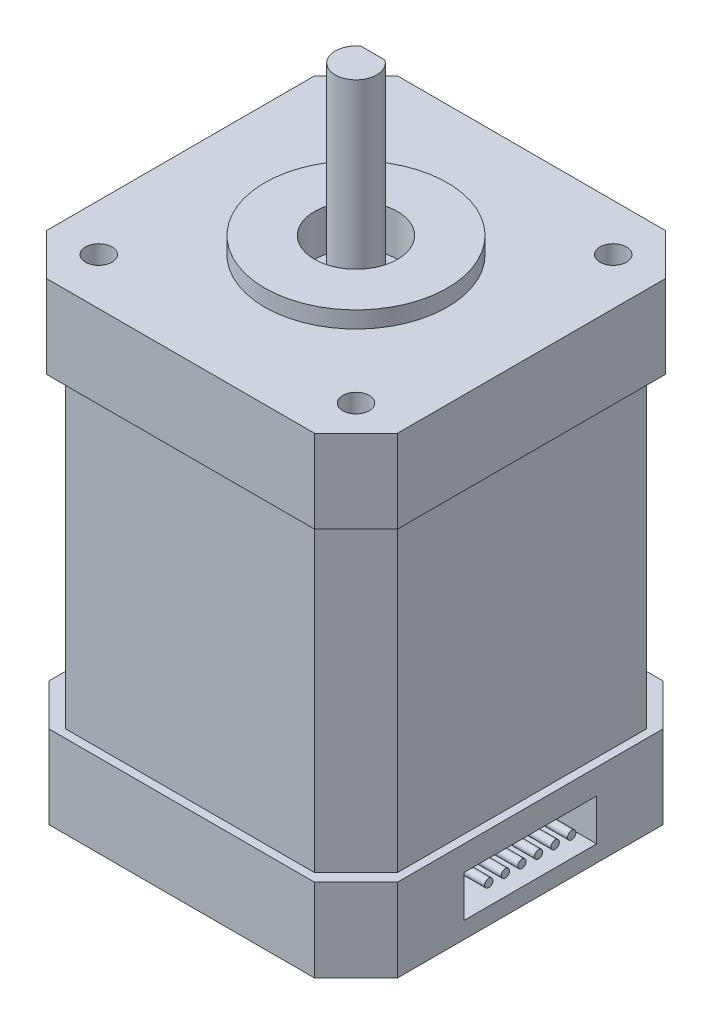
from build123d import *

# Parameters (mm, degrees)
SKETCH_1_W          = 42.3
SKETCH_1_H          = 42.3
EXTRUDE_1_DEPTH     = 10
CHAMFER_1_SIZE      = 5
SKETCH_2_R          = 1.6
CUT_EXTRUDE_1_DEPTH = 10
SKETCH_3_W          = 40
SKETCH_3_H          = 40
EXTRUDE_2_DEPTH     = 37
CHAMFER_2_SIZE      = 5
SKETCH_4_W          = 42
SKETCH_4_H          = 42
EXTRUDE_3_DEPTH     = 10
CHAMFER_3_SIZE      = 5
SKETCH_5_R          = 11
EXTRUDE_4_DEPTH     = 2
SKETCH_6_R          = 5
CUT_EXTRUDE_2_DEPTH = 5
EXTRUDE_5_DEPTH     = 23
CUT_EXTRUDE_START   = -3
SKETCH_8_R          = 5
CUT_EXTRUDE_3_DEPTH = 3
SKETCH_9_W          = 16
SKETCH_9_H          = 5
CUT_EXTRUDE_5_DEPTH = 5
SKETCH_10_R         = 0.5
EXTRUDE_6_DEPTH     = 5
SKETCH_11_R         = 2.5
CUT_EXTRUDE_6_DEPTH = 3
SKETCH_12_R         = 2
EXTRUDE_7_DEPTH     = 2
FILLET_3_R          = 1
CUT_EXTRUDE_7_DEPTH = 1
SCALE_1_SCALE       = 2


with BuildPart() as part:
    # 草图1 → 凸台-拉伸1 (new body)
    with BuildSketch(Plane(origin=(0, 0, 0), x_dir=(1, 0, 0), z_dir=(0, 1, 0))):
        Rectangle(SKETCH_1_W, SKETCH_1_H)
    extrude(amount=EXTRUDE_1_DEPTH)

    # 倒角1
    chamfer_1_edges = [part.edges().sort_by_distance(p)[0] for p in [
        (-21.15, 5, -21.15),
        (21.15, 5, -21.15),
        (21.15, 5, 21.15),
        (-21.15, 5, 21.15),
    ]]
    chamfer(chamfer_1_edges, length=CHAMFER_1_SIZE)

    # 草图2 → 切除-拉伸1 (cut)
    with BuildSketch(Plane(origin=(0, 10, 0), x_dir=(1, 0, 0), z_dir=(0, 1, 0))):
        with Locations(Location((-15.5, -15.5, 0), (0, 0, 270))):
            Circle(SKETCH_2_R)
        with Locations(Location((15.5, -15.5, 0), (0, 0, 270))):
            Circle(SKETCH_2_R)
        with Locations(Location((15.5, 15.5, 0), (0, 0, 270))):
            Circle(SKETCH_2_R)
        with Locations(Location((-15.5, 15.5, 0), (0, 0, 270))):
            Circle(SKETCH_2_R)
    extrude(amount=-CUT_EXTRUDE_1_DEPTH, mode=Mode.SUBTRACT)

    # 草图3 → 凸台-拉伸2 (add)
    with BuildSketch(Plane.XZ):
        Rectangle(SKETCH_3_W, SKETCH_3_H)
    extrude(amount=EXTRUDE_2_DEPTH)

    # 倒角2
    # the kernel refuses this chamfer: 5 mm, written as the material it takes off along each edge
    with BuildSketch(Plane(origin=(20, 0, -20), x_dir=(-0.9996219169112968, 0, -0.027495876610586317), z_dir=(0, -1, 0)), Plane(origin=(20, 0, 20), x_dir=(0.027495876610586317, 0, -0.9996219169112968), z_dir=(0, -1, 0))) as chamfer_2_piece_1:
        Polygon((CHAMFER_2_SIZE * 0.999621916911, -CHAMFER_2_SIZE * 0.0274958766106), (-CHAMFER_2_SIZE * 0.0274958766106, -CHAMFER_2_SIZE * 0.999621916911), (0, 0), align=None)
    extrude(amount=49.85841494, mode=Mode.SUBTRACT)
    with BuildSketch(Plane(origin=(-20, 0, 20), x_dir=(-0.027495876610586317, 0, -0.9996219169112968), z_dir=(0, -1, 0)), Plane(origin=(-20, 0, -20), x_dir=(0.9996219169112968, 0, -0.02749587661058631), z_dir=(0, -1, 0))) as chamfer_2_piece_2:
        Polygon((CHAMFER_2_SIZE * 0.999621916911, CHAMFER_2_SIZE * 0.0274958766106), (-CHAMFER_2_SIZE * 0.0274958766106, CHAMFER_2_SIZE * 0.999621916911), (0, 0), align=None)
    extrude(amount=49.85841494, mode=Mode.SUBTRACT)

    # 草图4 → 凸台-拉伸3 (add)
    with BuildSketch(Plane.XZ.offset(37)):
        Rectangle(SKETCH_4_W, SKETCH_4_H)
    extrude(amount=EXTRUDE_3_DEPTH)

    # 倒角3
    chamfer_3_edges = [part.edges().sort_by_distance(p)[0] for p in [
        (21, -42, -21),
        (21, -42, 21),
        (-21, -42, 21),
        (-21, -42, -21),
    ]]
    chamfer(chamfer_3_edges, length=CHAMFER_3_SIZE)

    # 草图5 → 凸台-拉伸4 (add)
    with BuildSketch(Plane(origin=(0, 10, 0), x_dir=(1, 0, 0), z_dir=(0, 1, 0))):
        with Locations(Location((0, 0, 0), (0, 0, 270))):
            Circle(SKETCH_5_R)
    extrude(amount=EXTRUDE_4_DEPTH)

    # 草图6 → 切除-拉伸2 (cut)
    with BuildSketch(Plane(origin=(0, 12, 0), x_dir=(1, 0, 0), z_dir=(0, 1, 0))):
        with Locations(Location((0, 0, 0), (0, 0, 270))):
            Circle(SKETCH_6_R)
    extrude(amount=-CUT_EXTRUDE_2_DEPTH, mode=Mode.SUBTRACT)

    # 草图7 → 凸台-拉伸5 (add)
    with BuildSketch(Plane(origin=(0, 7, 0), x_dir=(1, 0, 0), z_dir=(0, 1, 0))):
        with BuildLine():
            Line((-1.433902688, 2.047907), (1.433902688, 2.047907))
            ThreePointArc((1.433902688, 2.047907), (0, -2.5), (-1.433902688, 2.047907))
        make_face()
    extrude(amount=EXTRUDE_5_DEPTH)

    # 草图8 → 切除-拉伸3 (cut)
    with BuildSketch(Plane.XZ.offset(47).offset(CUT_EXTRUDE_START)):
        with Locations(Location((0, 0, 0), (0, 0, 90))):
            Circle(SKETCH_8_R)
    extrude(amount=CUT_EXTRUDE_3_DEPTH, mode=Mode.SUBTRACT)

    # 草图9 → 切除-拉伸5 (cut)
    with BuildSketch(Plane(origin=(21, 0, 0), x_dir=(0, 0, -1), z_dir=(1, 0, 0))):
        with Locations((0, -42.5)):
            Rectangle(SKETCH_9_W, SKETCH_9_H)
    extrude(amount=-CUT_EXTRUDE_5_DEPTH, mode=Mode.SUBTRACT)

    # 草图10 → 凸台-拉伸6 (add)
    with BuildSketch(Plane(origin=(16, 0, 0), x_dir=(0, 0, -1), z_dir=(1, 0, 0))):
        with Locations((-5, -42.576356784)):
            Circle(SKETCH_10_R)
        with Locations((-3, -42.576356784)):
            Circle(SKETCH_10_R)
        with Locations((-1, -42.576356784)):
            Circle(SKETCH_10_R)
        with Locations((1, -42.576356784)):
            Circle(SKETCH_10_R)
        with Locations((3, -42.576356784)):
            Circle(SKETCH_10_R)
        with Locations((5, -42.576356784)):
            Circle(SKETCH_10_R)
    extrude(amount=EXTRUDE_6_DEPTH)

    # 草图11 → 切除-拉伸6 (cut)
    with BuildSketch(Plane.XZ.offset(47)):
        with Locations(Location((-16, -16, 0), (0, 0, 270))):
            Circle(SKETCH_11_R)
        with Locations(Location((-16, 16, 0), (0, 0, 270))):
            Circle(SKETCH_11_R)
        with Locations(Location((16, -16, 0), (0, 0, 270))):
            Circle(SKETCH_11_R)
        with Locations(Location((16, 16, 0), (0, 0, 270))):
            Circle(SKETCH_11_R)
    extrude(amount=-CUT_EXTRUDE_6_DEPTH, mode=Mode.SUBTRACT)

    # 草图12 → 凸台-拉伸7 (add)
    with BuildSketch(Plane.XZ.offset(44)):
        with Locations(Location((16, -16, 0), (0, 0, 270))):
            Circle(SKETCH_12_R)
        with Locations(Location((-16, -16, 0), (0, 0, 270))):
            Circle(SKETCH_12_R)
        with Locations(Location((-16, 16, 0), (0, 0, 270))):
            Circle(SKETCH_12_R)
        with Locations(Location((16, 16, 0), (0, 0, 270))):
            Circle(SKETCH_12_R)
    extrude(amount=EXTRUDE_7_DEPTH)

    # 圆角3
    fillet_3_edges = [part.edges().sort_by_distance(p)[0] for p in [
        (16, -46, -14),
        (-16, -46, -14),
        (-16, -46, 18),
        (16, -46, 18),
    ]]
    fillet(fillet_3_edges, radius=FILLET_3_R)

    # 草图13 → 切除-拉伸7 (cut)
    with BuildSketch(Plane.XZ.offset(46)):
        Polygon((17.504917303, -16.201175931), (16.254917303, -16.201175931), (16.254917303, -17.451175931), (15.754917303, -17.451175931), (15.754917303, -16.201175931), (14.504917303, -16.201175931), (14.504917303, -15.701175931), (15.754917303, -15.701175931), (15.754917303, -14.451175931), (16.254917303, -14.451175931), (16.254917303, -15.701175931), (17.504917303, -15.701175931), align=None)
        Polygon((-14.533427421, -16.208852476), (-15.783427421, -16.208852476), (-15.783427421, -17.458852476), (-16.283427421, -17.458852476), (-16.283427421, -16.208852476), (-17.533427421, -16.208852476), (-17.533427421, -15.708852476), (-16.283427421, -15.708852476), (-16.283427421, -14.458852476), (-15.783427421, -14.458852476), (-15.783427421, -15.708852476), (-14.533427421, -15.708852476), align=None)
        Polygon((-14.499908472, 15.741364159), (-15.749908472, 15.741364159), (-15.749908472, 14.491364159), (-16.249908472, 14.491364159), (-16.249908472, 15.741364159), (-17.499908472, 15.741364159), (-17.499908472, 16.241364159), (-16.249908472, 16.241364159), (-16.249908472, 17.491364159), (-15.749908472, 17.491364159), (-15.749908472, 16.241364159), (-14.499908472, 16.241364159), align=None)
        Polygon((17.476381701, 15.755580117), (16.226381701, 15.755580117), (16.226381701, 14.505580117), (15.726381701, 14.505580117), (15.726381701, 15.755580117), (14.476381701, 15.755580117), (14.476381701, 16.255580117), (15.726381701, 16.255580117), (15.726381701, 17.505580117), (16.226381701, 17.505580117), (16.226381701, 16.255580117), (17.476381701, 16.255580117), align=None)
    extrude(amount=-CUT_EXTRUDE_7_DEPTH, mode=Mode.SUBTRACT)


with BuildPart() as part_1:
    # 缩放比例1: scaled about (-0.076032074, -18.004106641, 0.000490893)
    add(part.part.scale(SCALE_1_SCALE).moved(Location((0.076032074, 18.004106641, -0.000490893))))


solid = part_1.part
